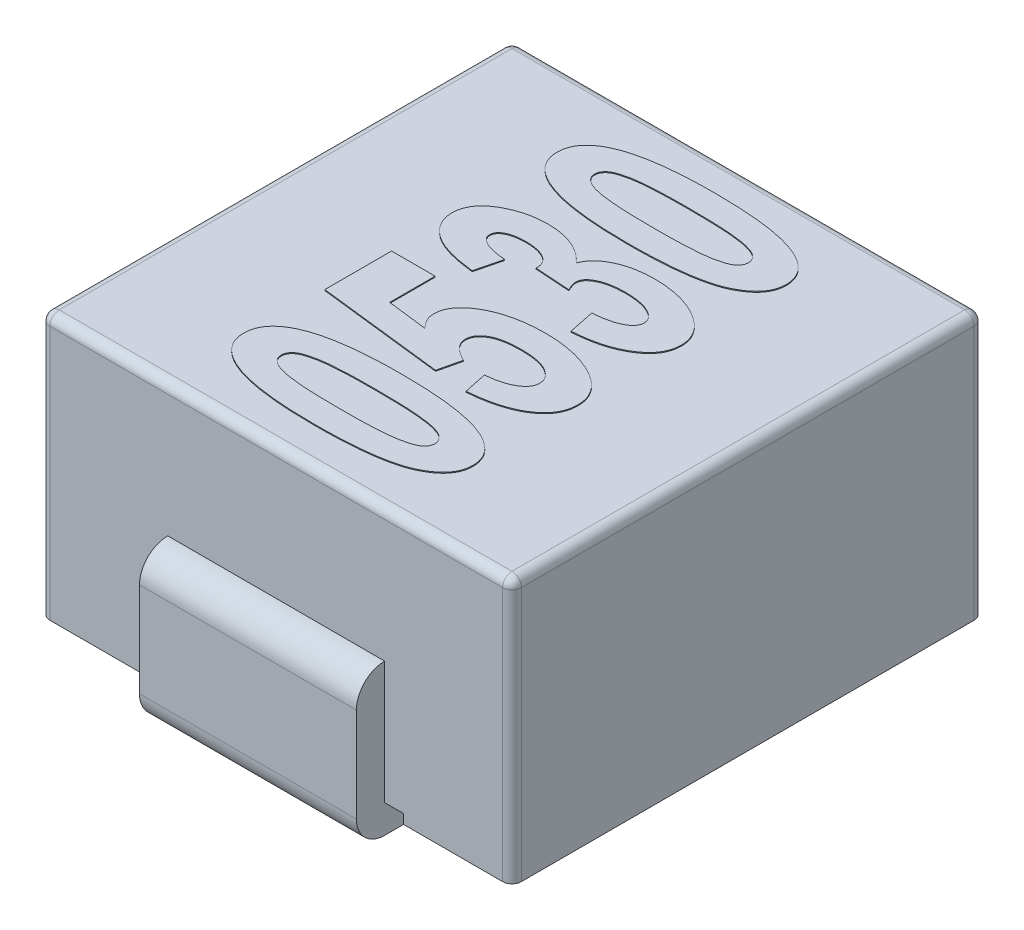
from build123d import *

# Parameters (mm, degrees)
EXTRUDE_1_DEPTH     = 2.8
SKETCH_2_W          = 2.7
SKETCH_2_H          = 1.5
CUT_EXTRUDE_1_DEPTH = 0.1
EXTRUDE_START       = -1.15
EXTRUDE_1_2_DEPTH   = 2.3
EXTRUDE_2_DEPTH     = 2.3
FILLET_1_R          = 0.1
EXTRUDE_2_2_DEPTH   = 0.01


# Read off the part's stored shape, not the designer's step: Вытянуть-Тонкостенный1, Вытянуть-Тонкостенный2
with BuildPart() as part:
    # Эскиз1 → Extrude 1 (new body)
    with BuildSketch(Plane(origin=(0, 0, 0), x_dir=(1, 0, 0), z_dir=(0, 1, 0))):
        with BuildLine():
            Line((-2.4, -2.5), (2.4, -2.5))
            ThreePointArc((2.4, -2.5), (2.470710678, -2.470710678), (2.5, -2.4))
            Line((2.5, -2.4), (2.5, 2.4))
            ThreePointArc((2.5, 2.4), (2.470710678, 2.470710678), (2.4, 2.5))
            Line((2.4, 2.5), (-2.4, 2.5))
            ThreePointArc((-2.4, 2.5), (-2.470710678, 2.470710678), (-2.5, 2.4))
            Line((-2.5, 2.4), (-2.5, -2.4))
            ThreePointArc((-2.5, -2.4), (-2.470710678, -2.470710678), (-2.4, -2.5))
        make_face()
    extrude(amount=EXTRUDE_1_DEPTH)

    # Эскиз2 → Вырез-Вытянуть1 (cut)
    with BuildSketch(Plane.XZ):
        with Locations((0, 1.75)):
            Rectangle(SKETCH_2_W, SKETCH_2_H)
        with Locations((0, -1.75)):
            Rectangle(SKETCH_2_W, SKETCH_2_H)
    extrude(amount=-CUT_EXTRUDE_1_DEPTH, mode=Mode.SUBTRACT)

    # Extrude 1 2 outline → Extrude 1 2 (add)
    with BuildSketch(Plane(origin=(0, 0, 0), x_dir=(0, 0, -1), z_dir=(1, 0, 0)).offset(EXTRUDE_START)):
        with BuildLine():
            Line((-2.5, -0.2), (-1.3, -0.2))
            Line((-1.3, -0.2), (-1.3, 0.1))
            Line((-1.3, 0.1), (-2.5, 0.1))
            Line((-2.5, 0.1), (-2.5, 1.4))
            ThreePointArc((-2.5, 1.4), (-2.712132034, 1.312132034), (-2.8, 1.1))
            Line((-2.8, 1.1), (-2.8, 0.1))
            ThreePointArc((-2.8, 0.1), (-2.712132034, -0.112132034), (-2.5, -0.2))
        make_face()
    extrude(amount=EXTRUDE_1_2_DEPTH)

    # Extrude 2 outline → Extrude 2 (add)
    with BuildSketch(Plane(origin=(0, 0, 0), x_dir=(0, 0, -1), z_dir=(1, 0, 0)).offset(EXTRUDE_START)):
        with BuildLine():
            Line((1.3, 0.1), (1.3, -0.2))
            Line((1.3, -0.2), (2.5, -0.2))
            ThreePointArc((2.5, -0.2), (2.712132034, -0.112132034), (2.8, 0.1))
            Line((2.8, 0.1), (2.8, 1.1))
            ThreePointArc((2.8, 1.1), (2.712132034, 1.312132034), (2.5, 1.4))
            Line((2.5, 1.4), (2.5, 0.1))
            Line((2.5, 0.1), (1.3, 0.1))
        make_face()
    extrude(amount=EXTRUDE_2_DEPTH)

    # Скругление1
    fillet_1_edges = [part.edges().sort_by_distance(p)[0] for p in [
        (2.470710678, 2.8, 2.470710678),
        (2.5, 2.8, 0),
        (2.470710678, 2.8, -2.470710678),
        (0, 2.8, -2.5),
        (-2.470710678, 2.8, -2.470710678),
        (-2.5, 2.8, 0),
        (-2.470710678, 2.8, 2.470710678),
        (0, 2.8, 2.5),
    ]]
    fillet(fillet_1_edges, radius=FILLET_1_R)

    # Эскиз4 → Extrude 2 2 (add)
    # profile 1 of 4: a face of its own
    with BuildSketch(Plane(origin=(0, 2.8, 0), x_dir=(1, 0, 0), z_dir=(0, 1, 0))):
        with BuildLine():
            add(Edge.make_bspline(
                [(-1.2, -1.646153846), (-1.199309715, -1.629253501), (-1.197958041, -1.596160306), (-1.185793698, -1.548078703), (-1.166470245, -1.502867295), (-1.139004646, -1.460609583), (-1.103884945, -1.421158931), (-1.060417613, -1.385474251), (-1.010385128, -1.351264445), (-0.972859505, -1.332713777), (-0.953365385, -1.323076923)],
                knots=[0, 0, 0, 0, 0.939629869, 1.83992419, 2.743264454, 3.666481804, 4.633505536, 5.672028627, 6.790646185, 8, 8, 8, 8], degree=3))
            add(Edge.make_bspline(
                [(-0.953365385, -1.323076923), (-0.927123507, -1.311640832), (-0.871811159, -1.287535963), (-0.779801708, -1.260678333), (-0.676676005, -1.236500759), (-0.561099308, -1.217913337), (-0.433796901, -1.202335844), (-0.294351077, -1.192489568), (-0.14302435, -1.185297543), (-0.038150985, -1.18484865), (0.016346154, -1.184615385)],
                knots=[0, 0, 0, 0, 0.695993191, 1.467006985, 2.327867947, 3.272915826, 4.313905632, 5.448135814, 6.673931191, 8, 8, 8, 8], degree=3))
            add(Edge.make_bspline(
                [(0.016346154, -1.184615385), (0.070677457, -1.185141856), (0.175370965, -1.186156337), (0.326612933, -1.19204691), (0.46577428, -1.203226465), (0.593243125, -1.217594551), (0.708810514, -1.237228123), (0.812596571, -1.260952867), (0.904887347, -1.288626174), (0.960602179, -1.312648387), (0.987019231, -1.324038462)],
                knots=[0, 0, 0, 0, 1.320779415, 2.545071084, 3.678366063, 4.713891943, 5.66240021, 6.526117529, 7.301162213, 8, 8, 8, 8], degree=3))
            add(Edge.make_bspline(
                [(0.987019231, -1.324038462), (1.006318002, -1.333727546), (1.043385966, -1.352337779), (1.093268966, -1.385719915), (1.135500564, -1.421817285), (1.170366646, -1.460780457), (1.197833331, -1.502758079), (1.216436161, -1.548198666), (1.228764656, -1.596144845), (1.230091583, -1.629248274), (1.230769231, -1.646153846)],
                knots=[0, 0, 0, 0, 1.209008214, 2.322193053, 3.353572777, 4.313995313, 5.243012364, 6.148517307, 7.054467326, 8, 8, 8, 8], degree=3))
            add(Edge.make_bspline(
                [(1.230769231, -1.646153846), (1.229929454, -1.663062241), (1.228266317, -1.696548472), (1.21514026, -1.745327945), (1.194259229, -1.791750532), (1.164394883, -1.83525343), (1.126193844, -1.876061199), (1.079541125, -1.913944291), (1.024781011, -1.949416398), (0.961551584, -1.983085233), (0.887324184, -2.013294316), (0.800260828, -2.037893186), (0.700791939, -2.060062475), (0.588014416, -2.077389082), (0.462425512, -2.091251484), (0.323658563, -2.100259708), (0.172019302, -2.106904711), (0.06651485, -2.107422498), (0.011538462, -2.107692308)],
                knots=[0, 0, 0, 0, 0.570946305, 1.130730606, 1.695682016, 2.284720325, 2.905752519, 3.57931678, 4.311109974, 5.108472247, 5.997836566, 7.014420583, 8.163245194, 9.441390503, 10.869501499, 12.433562194, 14.141596213, 16, 16, 16, 16], degree=3))
            add(Edge.make_bspline(
                [(0.011538462, -2.107692308), (-0.042473185, -2.107170627), (-0.146687675, -2.106164055), (-0.297277548, -2.100193781), (-0.436175446, -2.089295728), (-0.563185124, -2.073933541), (-0.678585193, -2.055276531), (-0.781963912, -2.031240826), (-0.874120923, -2.003696146), (-0.929833851, -1.97966401), (-0.95625, -1.968269231)],
                knots=[0, 0, 0, 0, 1.316839064, 2.540817049, 3.673540427, 4.712565747, 5.659351526, 6.521795573, 7.299112968, 8, 8, 8, 8], degree=3))
            add(Edge.make_bspline(
                [(-0.95625, -1.968269231), (-0.975552045, -1.958582865), (-1.012626298, -1.939977854), (-1.062466048, -1.906559805), (-1.1049362, -1.870506181), (-1.139276093, -1.831121479), (-1.167222098, -1.789498377), (-1.185638677, -1.744089524), (-1.198002852, -1.696167974), (-1.199324863, -1.663061151), (-1.2, -1.646153846)],
                knots=[0, 0, 0, 0, 1.209129629, 2.322426261, 3.353909562, 4.321163245, 5.242735491, 6.14833137, 7.05437237, 8, 8, 8, 8], degree=3))
        make_face()
        with BuildLine():
            add(Edge.make_bspline(
                [(-0.8, -1.646153846), (-0.799302143, -1.654573438), (-0.797888041, -1.671634485), (-0.787718104, -1.696151717), (-0.77100225, -1.718838802), (-0.74783497, -1.740451764), (-0.715928727, -1.759926016), (-0.674272371, -1.776358959), (-0.622746934, -1.790337251), (-0.584835815, -1.797555654), (-0.564423077, -1.801442308)],
                knots=[0, 0, 0, 0, 0.66053735, 1.338480494, 2.051183008, 2.861689582, 3.811811342, 4.969049189, 6.368024884, 8, 8, 8, 8], degree=3))
            add(Edge.make_bspline(
                [(-0.564423077, -1.801442308), (-0.548889387, -1.803763907), (-0.515327201, -1.80877997), (-0.461163795, -1.815082494), (-0.399383774, -1.81943608), (-0.330500642, -1.824102321), (-0.254172861, -1.826530909), (-0.170688005, -1.829137257), (-0.079651789, -1.830505379), (-0.016506718, -1.830678934), (0.016346154, -1.830769231)],
                knots=[0, 0, 0, 0, 0.647628605, 1.399270384, 2.247685976, 3.201110699, 4.24594481, 5.39623077, 6.6453211, 8, 8, 8, 8], degree=3))
            add(Edge.make_bspline(
                [(0.016346154, -1.830769231), (0.049038152, -1.830620108), (0.111699168, -1.830334284), (0.201619871, -1.829748053), (0.283507564, -1.827108217), (0.357542122, -1.824188136), (0.423634651, -1.821332756), (0.481613646, -1.816179728), (0.531699683, -1.811288373), (0.58597207, -1.803118439), (0.642858146, -1.792100209), (0.700304799, -1.776483965), (0.745427768, -1.759843903), (0.778810925, -1.74040172), (0.80179462, -1.718470093), (0.819160811, -1.696426076), (0.828506422, -1.671506533), (0.830019814, -1.654550371), (0.830769231, -1.646153846)],
                knots=[0, 0, 0, 0, 1.772229522, 3.396846643, 4.874325468, 6.213183949, 7.413572011, 8.459660885, 9.368179202, 10.14095794, 11.434081607, 12.506883432, 13.365124891, 14.035567992, 14.582591736, 15.079517174, 15.544185971, 16, 16, 16, 16], degree=3))
            add(Edge.make_bspline(
                [(0.830769231, -1.646153846), (0.830120146, -1.63755571), (0.828828482, -1.620445611), (0.818192235, -1.596011671), (0.802116897, -1.573012046), (0.778375251, -1.551929592), (0.746745978, -1.532335327), (0.705024588, -1.515965156), (0.653521642, -1.501965155), (0.615606962, -1.494750188), (0.595192308, -1.490865385)],
                knots=[0, 0, 0, 0, 0.672803919, 1.338864841, 2.061605897, 2.863308736, 3.813131099, 4.970004284, 6.368539142, 8, 8, 8, 8], degree=3))
            add(Edge.make_bspline(
                [(0.595192308, -1.490865385), (0.579658149, -1.48854774), (0.546252406, -1.483563715), (0.492415929, -1.477215492), (0.431114494, -1.472872813), (0.362553035, -1.468189028), (0.286384172, -1.46578027), (0.202899612, -1.463169361), (0.112023553, -1.461805095), (0.049038759, -1.461629569), (0.016346154, -1.461538462)],
                knots=[0, 0, 0, 0, 0.649769229, 1.397309303, 2.24191953, 3.191878681, 4.240166309, 5.394254338, 6.647473319, 8, 8, 8, 8], degree=3))
            add(Edge.make_bspline(
                [(0.016346154, -1.461538462), (-0.016345858, -1.461686965), (-0.079006901, -1.461971604), (-0.169087613, -1.462566975), (-0.251135927, -1.465191057), (-0.325331072, -1.468114269), (-0.391581093, -1.471001176), (-0.449725049, -1.476099506), (-0.49996812, -1.481026098), (-0.554088318, -1.489147138), (-0.610804434, -1.500253065), (-0.668207093, -1.515921056), (-0.713709237, -1.532449776), (-0.747419957, -1.551982588), (-0.771127938, -1.573499617), (-0.787703544, -1.596169735), (-0.797891498, -1.62066994), (-0.799303286, -1.637733175), (-0.8, -1.646153846)],
                knots=[0, 0, 0, 0, 1.769047239, 3.390747135, 4.874240912, 6.210695287, 7.408927887, 8.461780351, 9.368667298, 10.140058405, 11.422355672, 12.493231132, 13.358012728, 14.034682899, 14.587091034, 15.078019327, 15.545004449, 16, 16, 16, 16], degree=3))
        make_face(mode=Mode.SUBTRACT)
    # profile 2 of 4: a face of its own
    with BuildSketch(Plane(origin=(0, 2.8, 0), x_dir=(1, 0, 0), z_dir=(0, 1, 0))):
        with BuildLine():
            Line((0.513461538, -1), (0.461538462, -0.753846154))
            add(Edge.make_bspline(
                [(0.461538462, -0.753846154), (0.488543515, -0.751375714), (0.539890431, -0.746678466), (0.612038902, -0.731053624), (0.675812039, -0.710381781), (0.729985606, -0.683155585), (0.774207942, -0.652191066), (0.805979444, -0.617435044), (0.827161054, -0.579993922), (0.829578588, -0.55313296), (0.830769231, -0.539903846)],
                knots=[0, 0, 0, 0, 1.407758696, 2.676686699, 3.827332599, 4.881144903, 5.817156249, 6.613060699, 7.316927734, 8, 8, 8, 8], degree=3))
            add(Edge.make_bspline(
                [(0.830769231, -0.539903846), (0.829614504, -0.525100344), (0.827291061, -0.495313982), (0.806238068, -0.453350488), (0.772488971, -0.416183879), (0.735362308, -0.389703444), (0.700297511, -0.370317354), (0.669458834, -0.358070269), (0.635888394, -0.346709976), (0.598571579, -0.338544819), (0.558236467, -0.33099877), (0.514502263, -0.326571584), (0.467671548, -0.323559328), (0.435422294, -0.323241325), (0.41875, -0.323076923)],
                knots=[0, 0, 0, 0, 1.034051611, 2.080631741, 3.220339062, 4.532041754, 5.261927545, 6.028594457, 6.857440335, 7.746965165, 8.706828443, 9.736649533, 10.829887843, 12, 12, 12, 12], degree=3))
            add(Edge.make_bspline(
                [(0.41875, -0.323076923), (0.403044817, -0.323313411), (0.372737295, -0.323769779), (0.328558588, -0.325803447), (0.287749576, -0.331019623), (0.249552455, -0.336303145), (0.21479107, -0.344662367), (0.182716978, -0.354116031), (0.153701967, -0.365631466), (0.120439669, -0.382911792), (0.085385277, -0.407339063), (0.053597572, -0.442522604), (0.034415049, -0.483383063), (0.031992952, -0.512308839), (0.030769231, -0.526923077)],
                knots=[0, 0, 0, 0, 1.16702076, 2.252091488, 3.282897335, 4.222483009, 5.114869428, 5.935944765, 6.70532731, 7.429534691, 8.718069503, 9.857122197, 10.917348753, 12, 12, 12, 12], degree=3))
            add(Edge.make_bspline(
                [(0.030769231, -0.526923077), (0.031318404, -0.536287669), (0.032421575, -0.555099121), (0.041776782, -0.582676778), (0.056524715, -0.609412022), (0.077022222, -0.635477119), (0.103357254, -0.660536438), (0.135535552, -0.684477308), (0.173166974, -0.708097813), (0.200842248, -0.722329467), (0.215384615, -0.729807692)],
                knots=[0, 0, 0, 0, 0.777365265, 1.56155964, 2.396788521, 3.308817419, 4.308250754, 5.412128752, 6.64016616, 8, 8, 8, 8], degree=3))
            Line((0.215384615, -0.729807692), (0.158653846, -0.969230769))
            Line((0.158653846, -0.969230769), (-1.169230769, -0.815384615))
            Line((-1.169230769, -0.815384615), (-1.169230769, -0.107692308))
            Line((-1.169230769, -0.107692308), (-0.707692308, -0.107692308))
            Line((-0.707692308, -0.107692308), (-0.707692308, -0.589423077))
            Line((-0.707692308, -0.589423077), (-0.282211538, -0.640865385))
            add(Edge.make_bspline(
                [(-0.282211538, -0.640865385), (-0.295360989, -0.626507072), (-0.320246145, -0.599334161), (-0.348425006, -0.554382749), (-0.366059722, -0.508483491), (-0.36819319, -0.477222524), (-0.369230769, -0.462019231)],
                knots=[0, 0, 0, 0, 1.143752909, 2.164536708, 3.107350463, 4, 4, 4, 4], degree=3))
            add(Edge.make_bspline(
                [(-0.369230769, -0.462019231), (-0.36861002, -0.447691092), (-0.367380477, -0.419310732), (-0.356660269, -0.377777536), (-0.339870615, -0.337814717), (-0.31510039, -0.300209248), (-0.28451465, -0.263840649), (-0.247161402, -0.229018143), (-0.202654066, -0.196651437), (-0.152143379, -0.165987156), (-0.09642449, -0.13784961), (-0.035997739, -0.113542905), (0.028066189, -0.091987371), (0.09656119, -0.075722998), (0.168834141, -0.06182187), (0.245355909, -0.053280012), (0.325701297, -0.047139875), (0.380596125, -0.046487359), (0.408653846, -0.046153846)],
                knots=[0, 0, 0, 0, 0.711725397, 1.409745146, 2.120532269, 2.859164334, 3.640042284, 4.480467279, 5.392520005, 6.372852863, 7.417497191, 8.493786399, 9.610619135, 10.77656542, 11.993065377, 13.269678342, 14.604484161, 16, 16, 16, 16], degree=3))
            add(Edge.make_bspline(
                [(0.408653846, -0.046153846), (0.432380319, -0.046385277), (0.479082961, -0.04684082), (0.548242742, -0.051817769), (0.615301575, -0.059928608), (0.680558128, -0.07117102), (0.744005809, -0.08460828), (0.805245297, -0.10295392), (0.864808289, -0.123151424), (0.90313839, -0.139501388), (0.922115385, -0.147596154)],
                knots=[0, 0, 0, 0, 1.079805715, 2.125464639, 3.154194097, 4.153139282, 5.13897498, 6.103889648, 7.061247531, 8, 8, 8, 8], degree=3))
            add(Edge.make_bspline(
                [(0.922115385, -0.147596154), (0.94642427, -0.159107826), (0.993212122, -0.181264597), (1.056186939, -0.221247498), (1.110121239, -0.264282548), (1.15425033, -0.310893338), (1.188708766, -0.361139772), (1.213162378, -0.414935209), (1.228080175, -0.472276587), (1.229866472, -0.511771051), (1.230769231, -0.531730769)],
                knots=[0, 0, 0, 0, 1.232211664, 2.37166512, 3.411302611, 4.388546507, 5.303567267, 6.191367956, 7.085953247, 8, 8, 8, 8], degree=3))
            add(Edge.make_bspline(
                [(1.230769231, -0.531730769), (1.230276194, -0.547802652), (1.229306353, -0.579417243), (1.219761197, -0.625707795), (1.204421413, -0.669548726), (1.1828544, -0.711121967), (1.15507282, -0.750285442), (1.121386298, -0.787317924), (1.081267329, -0.821641116), (1.035813559, -0.853570912), (0.985185543, -0.882757316), (0.930298073, -0.909279943), (0.870952898, -0.932324899), (0.807390608, -0.951800645), (0.73982888, -0.96865223), (0.668122914, -0.982616482), (0.592181799, -0.993077884), (0.540087194, -0.997658724), (0.513461538, -1)],
                knots=[0, 0, 0, 0, 0.818746466, 1.610535326, 2.398900263, 3.181141225, 3.990616551, 4.841094953, 5.727567066, 6.67764902, 7.670093515, 8.704554039, 9.78363785, 10.913284538, 12.092685878, 13.333278512, 14.637033372, 16, 16, 16, 16], degree=3))
        make_face()
    # profile 3 of 4: a face of its own
    with BuildSketch(Plane(origin=(0, 2.8, 0), x_dir=(1, 0, 0), z_dir=(0, 1, 0))):
        with BuildLine():
            Line((0.518269231, 0.107692308), (0.461538462, 0.384615385))
            add(Edge.make_bspline(
                [(0.461538462, 0.384615385), (0.489812443, 0.38680101), (0.542957962, 0.390909246), (0.616993424, 0.404777527), (0.680969435, 0.421558903), (0.733955089, 0.444780306), (0.776247354, 0.471204118), (0.807517674, 0.500771554), (0.827403333, 0.534313777), (0.829665136, 0.558423292), (0.830769231, 0.570192308)],
                knots=[0, 0, 0, 0, 1.523447153, 2.86356515, 4.044691162, 5.070845881, 5.96228464, 6.71166558, 7.371101897, 8, 8, 8, 8], degree=3))
            add(Edge.make_bspline(
                [(0.830769231, 0.570192308), (0.829585319, 0.582793832), (0.827165909, 0.608545972), (0.805471183, 0.644163793), (0.771989484, 0.675716322), (0.726198967, 0.702709602), (0.670670341, 0.726454968), (0.604836724, 0.741959169), (0.53061475, 0.752234209), (0.47808569, 0.753290864), (0.450480769, 0.753846154)],
                knots=[0, 0, 0, 0, 0.653407149, 1.335285515, 2.116371688, 3.040580462, 4.094240927, 5.259113078, 6.559617015, 8, 8, 8, 8], degree=3))
            add(Edge.make_bspline(
                [(0.450480769, 0.753846154), (0.424327128, 0.753408233), (0.374883949, 0.752580347), (0.304772734, 0.743381921), (0.243115603, 0.728512716), (0.190517153, 0.707531108), (0.147850802, 0.682620585), (0.116286486, 0.654286222), (0.096205572, 0.621836937), (0.093590596, 0.598478732), (0.092307692, 0.587019231)],
                knots=[0, 0, 0, 0, 1.462861503, 2.765524062, 3.948827205, 5.003040426, 5.924358409, 6.69846313, 7.361467914, 8, 8, 8, 8], degree=3))
            add(Edge.make_bspline(
                [(0.092307692, 0.587019231), (0.092649941, 0.578961067), (0.09337943, 0.561785395), (0.101051189, 0.5353306), (0.111327544, 0.506350553), (0.121227915, 0.487075166), (0.126442308, 0.476923077)],
                knots=[0, 0, 0, 0, 0.829318464, 1.767660946, 2.824256753, 4, 4, 4, 4], degree=3))
            Line((0.126442308, 0.476923077), (-0.246153846, 0.501923077))
            add(Edge.make_bspline(
                [(-0.246153846, 0.501923077), (-0.246167779, 0.516655167), (-0.246194621, 0.545038133), (-0.261927617, 0.584786033), (-0.287856977, 0.618837575), (-0.325244977, 0.645238844), (-0.369967726, 0.6667126), (-0.422262359, 0.681903241), (-0.481092742, 0.690942451), (-0.522561371, 0.691839132), (-0.544230769, 0.692307692)],
                knots=[0, 0, 0, 0, 0.880596346, 1.696564192, 2.523146792, 3.426942696, 4.424544274, 5.502942066, 6.695164371, 8, 8, 8, 8], degree=3))
            add(Edge.make_bspline(
                [(-0.544230769, 0.692307692), (-0.562674067, 0.69179526), (-0.597751481, 0.690820661), (-0.647653757, 0.684949815), (-0.691733461, 0.673884622), (-0.729773917, 0.659055675), (-0.760355431, 0.639973136), (-0.783376628, 0.618012173), (-0.797574689, 0.591806203), (-0.799191093, 0.572915253), (-0.8, 0.563461538)],
                knots=[0, 0, 0, 0, 1.408975371, 2.679738345, 3.828641486, 4.871951251, 5.785399761, 6.564373782, 7.281560709, 8, 8, 8, 8], degree=3))
            add(Edge.make_bspline(
                [(-0.8, 0.563461538), (-0.799106488, 0.553950689), (-0.797280835, 0.534517798), (-0.780278246, 0.507951918), (-0.754819679, 0.484298784), (-0.720110802, 0.462695659), (-0.675867341, 0.44482078), (-0.622545158, 0.430779605), (-0.560439632, 0.420232495), (-0.515909215, 0.417063965), (-0.492307692, 0.415384615)],
                knots=[0, 0, 0, 0, 0.614593592, 1.255758524, 1.994293265, 2.872073712, 3.90185238, 5.092465769, 6.458980683, 8, 8, 8, 8], degree=3))
            Line((-0.492307692, 0.415384615), (-0.561538462, 0.138461538))
            add(Edge.make_bspline(
                [(-0.561538462, 0.138461538), (-0.596680226, 0.142952199), (-0.66350331, 0.151491319), (-0.757809069, 0.168521817), (-0.841065096, 0.189052094), (-0.91391966, 0.212886289), (-0.977923974, 0.241052485), (-1.03396331, 0.274270315), (-1.083273328, 0.312403309), (-1.124607168, 0.355753595), (-1.158338381, 0.4027693), (-1.181978801, 0.45350906), (-1.197381958, 0.506797592), (-1.199121278, 0.543484589), (-1.2, 0.562019231)],
                knots=[0, 0, 0, 0, 1.516545581, 2.883755412, 4.100129637, 5.184916199, 6.161561536, 7.087565235, 7.967299716, 8.821351288, 9.643645262, 10.432397742, 11.208031512, 12, 12, 12, 12], degree=3))
            add(Edge.make_bspline(
                [(-1.2, 0.562019231), (-1.199363701, 0.577777878), (-1.198103618, 0.608985211), (-1.187738014, 0.654446476), (-1.17068225, 0.697407525), (-1.146747769, 0.737719521), (-1.11588452, 0.775656444), (-1.078258906, 0.811001871), (-1.034055786, 0.844071962), (-1.001185785, 0.862853377), (-0.984134615, 0.872596154)],
                knots=[0, 0, 0, 0, 0.947568756, 1.876499546, 2.789879743, 3.719461166, 4.686463274, 5.723414899, 6.819031449, 8, 8, 8, 8], degree=3))
            add(Edge.make_bspline(
                [(-0.984134615, 0.872596154), (-0.954043621, 0.88756102), (-0.893544509, 0.917648465), (-0.795411395, 0.947359824), (-0.691876424, 0.965654456), (-0.620913376, 0.968020516), (-0.584615385, 0.969230769)],
                knots=[0, 0, 0, 0, 0.969902279, 1.95002621, 2.951427064, 4, 4, 4, 4], degree=3))
            add(Edge.make_bspline(
                [(-0.584615385, 0.969230769), (-0.558946359, 0.968563394), (-0.508705078, 0.96725716), (-0.43537778, 0.957666977), (-0.366028572, 0.941121409), (-0.300543229, 0.918653014), (-0.238895628, 0.889798955), (-0.181748336, 0.853584988), (-0.128012048, 0.811550343), (-0.096266577, 0.778602516), (-0.080288462, 0.762019231)],
                knots=[0, 0, 0, 0, 1.095736826, 2.144655767, 3.150308815, 4.134792802, 5.095793217, 6.048747144, 7.017896297, 8, 8, 8, 8], degree=3))
            add(Edge.make_bspline(
                [(-0.080288462, 0.762019231), (-0.076388364, 0.772079825), (-0.068538016, 0.79233039), (-0.051874135, 0.820480384), (-0.032335617, 0.847305804), (-0.009854069, 0.872821966), (0.016512111, 0.896559679), (0.046204414, 0.918503886), (0.079377667, 0.938692511), (0.12795432, 0.964807601), (0.195584947, 0.991580704), (0.283686703, 1.014680363), (0.379724835, 1.028001907), (0.446272358, 1.029824458), (0.480769231, 1.030769231)],
                knots=[0, 0, 0, 0, 0.588174819, 1.183913443, 1.778880718, 2.398610744, 3.036537093, 3.711935979, 4.411165352, 5.15479404, 6.720886317, 8.367571312, 10.117023395, 12, 12, 12, 12], degree=3))
            add(Edge.make_bspline(
                [(0.480769231, 1.030769231), (0.506262072, 1.030443767), (0.556366363, 1.029804091), (0.630088042, 1.02346449), (0.700832698, 1.012748594), (0.768978335, 0.99876583), (0.83375012, 0.979002711), (0.896314544, 0.956895654), (0.955340282, 0.929073227), (1.01139523, 0.898374711), (1.062142774, 0.863959881), (1.107773115, 0.828209159), (1.145135627, 0.788899307), (1.176701883, 0.748292157), (1.200715023, 0.705248956), (1.218660325, 0.660291889), (1.228796377, 0.612952864), (1.230109402, 0.580654049), (1.230769231, 0.564423077)],
                knots=[0, 0, 0, 0, 1.258720749, 2.473922433, 3.65023362, 4.791082452, 5.90538078, 6.991932887, 8.064795236, 9.124027415, 10.144685252, 11.090198737, 11.980125562, 12.815865701, 13.623750765, 14.405594193, 15.198770716, 16, 16, 16, 16], degree=3))
            add(Edge.make_bspline(
                [(1.230769231, 0.564423077), (1.230311492, 0.548984073), (1.229405715, 0.518433264), (1.219258367, 0.473953517), (1.203595576, 0.431545382), (1.182551055, 0.390711441), (1.154030339, 0.352561159), (1.119620621, 0.316498051), (1.079367159, 0.282157681), (1.033368421, 0.250323966), (0.982427507, 0.220962884), (0.927027944, 0.195373572), (0.868233408, 0.172043304), (0.805535724, 0.152444053), (0.73905321, 0.136127347), (0.668885558, 0.123278471), (0.594894755, 0.113620443), (0.5442533, 0.109702566), (0.518269231, 0.107692308)],
                knots=[0, 0, 0, 0, 0.797530121, 1.578158177, 2.346760491, 3.133004649, 3.945606798, 4.801914937, 5.707542233, 6.678205964, 7.692237657, 8.745640536, 9.832671599, 10.962893774, 12.141326967, 13.372401462, 14.651782352, 16, 16, 16, 16], degree=3))
        make_face()
    # profile 4 of 4: a face of its own
    with BuildSketch(Plane(origin=(0, 2.8, 0), x_dir=(1, 0, 0), z_dir=(0, 1, 0))):
        with BuildLine():
            add(Edge.make_bspline(
                [(-1.2, 1.676923077), (-1.199309715, 1.693823422), (-1.197958041, 1.726916617), (-1.185793698, 1.77499822), (-1.166470245, 1.820209628), (-1.139004646, 1.86246734), (-1.103884945, 1.901917992), (-1.060417613, 1.937602672), (-1.010385128, 1.971812478), (-0.972859505, 1.990363146), (-0.953365385, 2)],
                knots=[0, 0, 0, 0, 0.939629869, 1.83992419, 2.743264454, 3.666481804, 4.633505536, 5.672028627, 6.790646185, 8, 8, 8, 8], degree=3))
            add(Edge.make_bspline(
                [(-0.953365385, 2), (-0.927123507, 2.011436091), (-0.871811159, 2.03554096), (-0.779801708, 2.06239859), (-0.676676005, 2.086576164), (-0.561099308, 2.105163586), (-0.433796901, 2.120741079), (-0.294351077, 2.130587355), (-0.14302435, 2.13777938), (-0.038150985, 2.138228273), (0.016346154, 2.138461538)],
                knots=[0, 0, 0, 0, 0.695993191, 1.467006985, 2.327867947, 3.272915826, 4.313905632, 5.448135814, 6.673931191, 8, 8, 8, 8], degree=3))
            add(Edge.make_bspline(
                [(0.016346154, 2.138461538), (0.070677457, 2.137935067), (0.175370965, 2.136920586), (0.326612933, 2.131030013), (0.46577428, 2.119850458), (0.593243125, 2.105482372), (0.708810514, 2.0858488), (0.812596571, 2.062124056), (0.904887347, 2.034450749), (0.960602179, 2.010428536), (0.987019231, 1.999038462)],
                knots=[0, 0, 0, 0, 1.320779415, 2.545071084, 3.678366063, 4.713891943, 5.66240021, 6.526117529, 7.301162213, 8, 8, 8, 8], degree=3))
            add(Edge.make_bspline(
                [(0.987019231, 1.999038462), (1.006318002, 1.989349377), (1.043385966, 1.970739144), (1.093268966, 1.937357008), (1.135500564, 1.901259638), (1.170366646, 1.862296466), (1.197833331, 1.820318844), (1.216436161, 1.774878257), (1.228764656, 1.726932078), (1.230091583, 1.693828649), (1.230769231, 1.676923077)],
                knots=[0, 0, 0, 0, 1.209008214, 2.322193053, 3.353572777, 4.313995313, 5.243012364, 6.148517307, 7.054467326, 8, 8, 8, 8], degree=3))
            add(Edge.make_bspline(
                [(1.230769231, 1.676923077), (1.229929454, 1.660014682), (1.228266317, 1.626528451), (1.21514026, 1.577748978), (1.194259229, 1.531326391), (1.164394883, 1.487823493), (1.126193844, 1.447015725), (1.079541125, 1.409132632), (1.024781011, 1.373660525), (0.961551584, 1.33999169), (0.887324184, 1.309782607), (0.800260828, 1.285183737), (0.700791939, 1.263014448), (0.588014416, 1.245687841), (0.462425512, 1.231825439), (0.323658563, 1.222817215), (0.172019302, 1.216172212), (0.06651485, 1.215654425), (0.011538462, 1.215384615)],
                knots=[0, 0, 0, 0, 0.570946305, 1.130730606, 1.695682016, 2.284720325, 2.905752519, 3.57931678, 4.311109974, 5.108472247, 5.997836566, 7.014420583, 8.163245194, 9.441390503, 10.869501499, 12.433562194, 14.141596213, 16, 16, 16, 16], degree=3))
            add(Edge.make_bspline(
                [(0.011538462, 1.215384615), (-0.042473185, 1.215906296), (-0.146687675, 1.216912868), (-0.297277548, 1.222883142), (-0.436175446, 1.233781195), (-0.563185124, 1.249143382), (-0.678585193, 1.267800392), (-0.781963912, 1.291836097), (-0.874120923, 1.319380777), (-0.929833851, 1.343412913), (-0.95625, 1.354807692)],
                knots=[0, 0, 0, 0, 1.316839064, 2.540817049, 3.673540427, 4.712565747, 5.659351526, 6.521795573, 7.299112968, 8, 8, 8, 8], degree=3))
            add(Edge.make_bspline(
                [(-0.95625, 1.354807692), (-0.975552045, 1.364494058), (-1.012626298, 1.383099069), (-1.062466048, 1.416517118), (-1.1049362, 1.452570742), (-1.139276093, 1.491955444), (-1.167222098, 1.533578546), (-1.185638677, 1.578987399), (-1.198002852, 1.626908949), (-1.199324863, 1.660015772), (-1.2, 1.676923077)],
                knots=[0, 0, 0, 0, 1.209129629, 2.322426261, 3.353909562, 4.321163245, 5.242735491, 6.14833137, 7.05437237, 8, 8, 8, 8], degree=3))
        make_face()
        with BuildLine():
            add(Edge.make_bspline(
                [(-0.8, 1.676923077), (-0.799302143, 1.668503485), (-0.797888041, 1.651442438), (-0.787718104, 1.626925206), (-0.77100225, 1.604238122), (-0.74783497, 1.582625159), (-0.715928727, 1.563150907), (-0.674272371, 1.546717964), (-0.622746934, 1.532739672), (-0.584835815, 1.525521269), (-0.564423077, 1.521634615)],
                knots=[0, 0, 0, 0, 0.66053735, 1.338480494, 2.051183008, 2.861689582, 3.811811342, 4.969049189, 6.368024884, 8, 8, 8, 8], degree=3))
            add(Edge.make_bspline(
                [(-0.564423077, 1.521634615), (-0.548889387, 1.519313016), (-0.515327201, 1.514296954), (-0.461163795, 1.507994429), (-0.399383774, 1.503640843), (-0.330500642, 1.498974602), (-0.254172861, 1.496546014), (-0.170688005, 1.493939667), (-0.079651789, 1.492571544), (-0.016506718, 1.492397989), (0.016346154, 1.492307692)],
                knots=[0, 0, 0, 0, 0.647628605, 1.399270384, 2.247685976, 3.201110699, 4.24594481, 5.39623077, 6.6453211, 8, 8, 8, 8], degree=3))
            add(Edge.make_bspline(
                [(0.016346154, 1.492307692), (0.049038152, 1.492456815), (0.111699168, 1.492742639), (0.201619871, 1.49332887), (0.283507564, 1.495968706), (0.357542122, 1.498888787), (0.423634651, 1.501744167), (0.481613646, 1.506897195), (0.531699683, 1.51178855), (0.58597207, 1.519958484), (0.642858146, 1.530976714), (0.700304799, 1.546592958), (0.745427768, 1.56323302), (0.778810925, 1.582675203), (0.80179462, 1.60460683), (0.819160811, 1.626650848), (0.828506422, 1.65157039), (0.830019814, 1.668526552), (0.830769231, 1.676923077)],
                knots=[0, 0, 0, 0, 1.772229522, 3.396846643, 4.874325468, 6.213183949, 7.413572011, 8.459660885, 9.368179202, 10.14095794, 11.434081607, 12.506883432, 13.365124891, 14.035567992, 14.582591736, 15.079517174, 15.544185971, 16, 16, 16, 16], degree=3))
            add(Edge.make_bspline(
                [(0.830769231, 1.676923077), (0.830120146, 1.685521213), (0.828828482, 1.702631312), (0.818192235, 1.727065252), (0.802116897, 1.750064877), (0.778375251, 1.771147331), (0.746745978, 1.790741596), (0.705024588, 1.807111767), (0.653521642, 1.821111768), (0.615606962, 1.828326735), (0.595192308, 1.832211538)],
                knots=[0, 0, 0, 0, 0.672803919, 1.338864841, 2.061605897, 2.863308736, 3.813131099, 4.970004284, 6.368539142, 8, 8, 8, 8], degree=3))
            add(Edge.make_bspline(
                [(0.595192308, 1.832211538), (0.579658149, 1.834529183), (0.546252406, 1.839513208), (0.492415929, 1.845861432), (0.431114494, 1.85020411), (0.362553035, 1.854887895), (0.286384172, 1.857296653), (0.202899612, 1.859907562), (0.112023553, 1.861271828), (0.049038759, 1.861447354), (0.016346154, 1.861538462)],
                knots=[0, 0, 0, 0, 0.649769229, 1.397309303, 2.24191953, 3.191878681, 4.240166309, 5.394254338, 6.647473319, 8, 8, 8, 8], degree=3))
            add(Edge.make_bspline(
                [(0.016346154, 1.861538462), (-0.016345858, 1.861389958), (-0.079006901, 1.861105319), (-0.169087613, 1.860509948), (-0.251135927, 1.857885866), (-0.325331072, 1.854962654), (-0.391581093, 1.852075747), (-0.449725049, 1.846977417), (-0.49996812, 1.842050825), (-0.554088318, 1.833929785), (-0.610804434, 1.822823858), (-0.668207093, 1.807155867), (-0.713709237, 1.790627147), (-0.747419957, 1.771094336), (-0.771127938, 1.749577306), (-0.787703544, 1.726907188), (-0.797891498, 1.702406983), (-0.799303286, 1.685343748), (-0.8, 1.676923077)],
                knots=[0, 0, 0, 0, 1.769047239, 3.390747135, 4.874240912, 6.210695287, 7.408927887, 8.461780351, 9.368667298, 10.140058405, 11.422355672, 12.493231132, 13.358012728, 14.034682899, 14.587091034, 15.078019327, 15.545004449, 16, 16, 16, 16], degree=3))
        make_face(mode=Mode.SUBTRACT)
    extrude(amount=EXTRUDE_2_2_DEPTH)


solid = part.part
